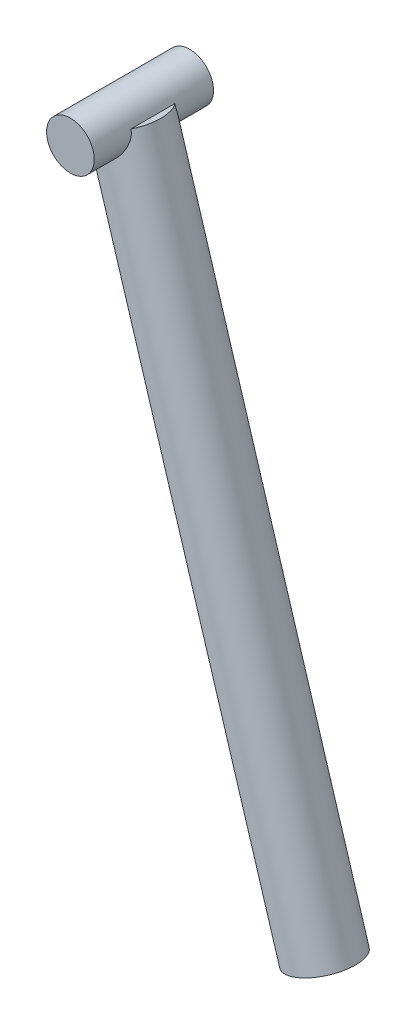
from build123d import *

# Parameters (mm, degrees)
TUBO_TIJA_PROFILE_R = 13.6
CABEZA_PROFILE_R    = 10


with BuildPart() as part:
    # Tubo_tija: sweep along a curve in space
    with BuildLine() as tubo_tija_path:
        Line((-115.633009218, 378.218530983, 0), (-197.165716473, 644.9, 0))
    # Tubo_tija profile (on start of the path) → Tubo_tija (sweep)
    with BuildSketch(Plane(origin=(-115.633009218, 378.218530983, 0), x_dir=(0.9563047559630354, 0.2923717047227369, 0), z_dir=(-0.2923717047227369, 0.9563047559630354, 0))):
        Circle(TUBO_TIJA_PROFILE_R)
    sweep(path=tubo_tija_path.line)

    # Cabeza: sweep along a curve in space
    with BuildLine() as cabeza_path:
        Line((-197.165716473, 644.9, -25), (-197.165716473, 644.9, 25))
    # Cabeza profile (on start of the path) → Cabeza (sweep)
    with BuildSketch(Plane(origin=(-197.165716473, 644.9, -25), x_dir=(1, 0, 0), z_dir=(0, 0, 1))):
        Circle(CABEZA_PROFILE_R)
    sweep(path=cabeza_path.line)


solid = part.part
